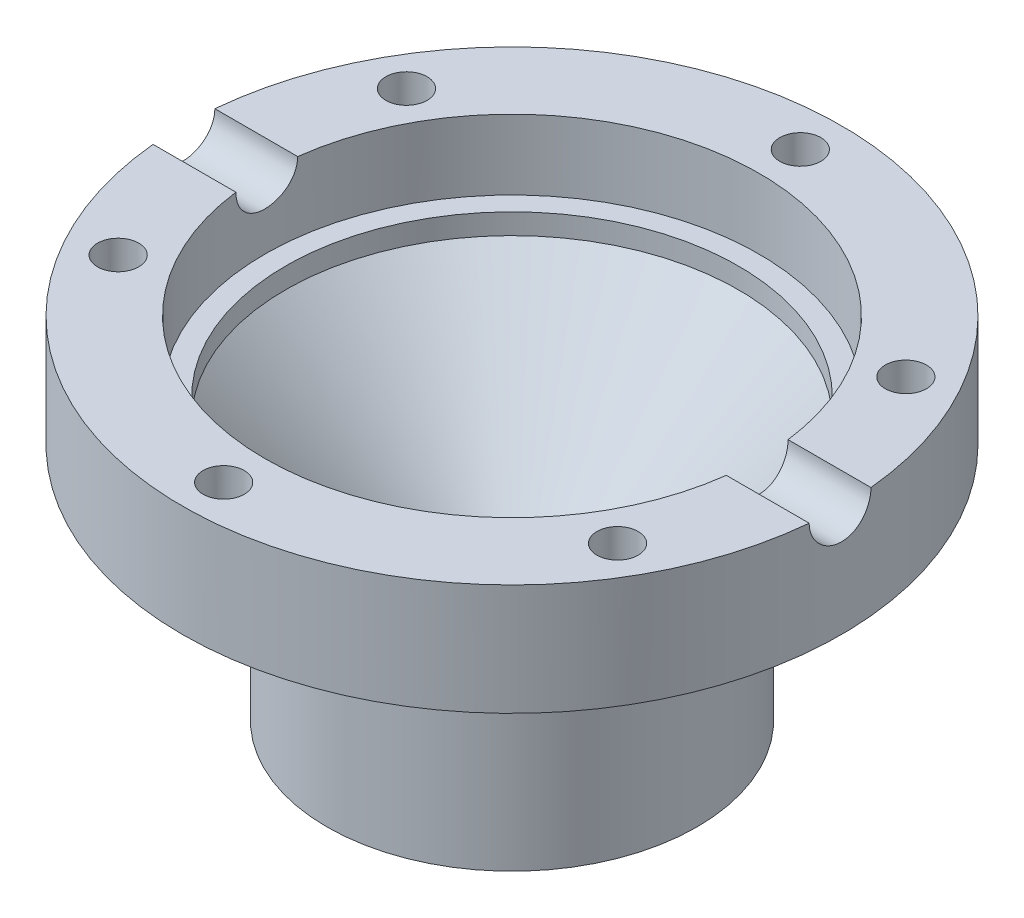
from build123d import *

# Parameters (mm, degrees)
SKETCH1_R           = 20.32
BOSS_EXTRUDE1_DEPTH = 21.59
SKETCH2_W           = 15.24
SKETCH2_H           = 4.318
SKETCH3_W           = 5.08
SKETCH3_H           = 14.732
CUT_EXTRUDE1_REACH  = 37.943
SKETCH4_R           = 1.27
CIRPATTERN1_COUNT   = 6
CUT_EXTRUDE2_REACH  = 37.943
SKETCH5_R           = 4.699
SKETCH9_R           = 1.905
CUT_EXTRUDE3_DEPTH  = 51.305467894


with BuildPart() as part:
    # Sketch1 → Boss-Extrude1 (new body)
    with BuildSketch(Plane(origin=(0, 0, 0), x_dir=(1, 0, 0), z_dir=(0, 1, 0))):
        Circle(SKETCH1_R)
    extrude(amount=BOSS_EXTRUDE1_DEPTH)

    # Sketch2 → Cut-Revolve1 (revolve, cut)
    with BuildSketch(Plane.XY):
        with Locations((-7.62, 19.431)):
            Rectangle(SKETCH2_W, SKETCH2_H)
    revolve(axis=Axis((0, 55, 0), (0, -1, 0)), mode=Mode.SUBTRACT)

    # Sketch3 → Cut-Revolve2 (revolve, cut)
    with BuildSketch(Plane.XY):
        with Locations((-17.78, 7.366)):
            Rectangle(SKETCH3_W, SKETCH3_H)
    revolve(axis=Axis((0, 55, 0), (0, -1, 0)), mode=Mode.SUBTRACT)

    # Sketch4 → Cut-Extrude1 (cut, up to next)
    with BuildSketch(Plane(origin=(0, 21.59, 0), x_dir=(1, 0, 0), z_dir=(0, 1, 0)), mode=Mode.PRIVATE) as cut_extrude1_sk1:
        with Locations((0, 17.78)):
            Circle(SKETCH4_R)
    cut_extrude1_tool1 = extrude(cut_extrude1_sk1.sketch, amount=-CUT_EXTRUDE1_REACH, mode=Mode.PRIVATE) & part.part
    cut_extrude1 = cut_extrude1_tool1.solids().sort_by_distance((0, 21.59, -17.78))[0]
    add(cut_extrude1, mode=Mode.SUBTRACT)

    # CirPattern1: Cut-Extrude1 ×6 about axis
    cirpattern1_axis = Axis((0, 55, 0), (0, -1, 0))
    for i in range(1, CIRPATTERN1_COUNT):
        add(cut_extrude1.rotate(cirpattern1_axis, i * 360 / CIRPATTERN1_COUNT), mode=Mode.SUBTRACT)

    # Sketch5 → Cut-Extrude2 (cut, up to next)
    with BuildSketch(Plane.XZ, mode=Mode.PRIVATE) as cut_extrude2_sk1:
        Circle(SKETCH5_R)
    cut_extrude2_tool1 = extrude(cut_extrude2_sk1.sketch, amount=-CUT_EXTRUDE2_REACH, mode=Mode.PRIVATE) & part.part
    add(cut_extrude2_tool1.solids().sort_by_distance((0, 0, 0))[0], mode=Mode.SUBTRACT)

    # Sketch7 → Cut-Revolve3 (revolve, cut)
    with BuildSketch(Plane.XY):
        Polygon((-15.24, 14.732), (-11.40968, 10.90168), (-11.40968, 0), (-15.24, 0), align=None)
    revolve(axis=Axis((0, 55, 0), (0, -1, 0)), mode=Mode.SUBTRACT)

    # Sketch8 → Cut-Revolve4 (revolve, cut)
    with BuildSketch(Plane.XY):
        Polygon((-4.699, 17.272), (-13.97, 17.272), (-13.97, 16.002), (-4.699, 6.731), align=None)
    revolve(axis=Axis((0, 55, 0), (0, -1, 0)), mode=Mode.SUBTRACT)

    # Sketch9 → Cut-Extrude3 (cut, through all)
    with BuildSketch(Plane(origin=(20.32, 0, 0), x_dir=(0, 0, -1), z_dir=(1, 0, 0))):
        with Locations((0, 21.59)):
            Circle(SKETCH9_R)
    extrude(amount=-CUT_EXTRUDE3_DEPTH, mode=Mode.SUBTRACT)


solid = part.part
